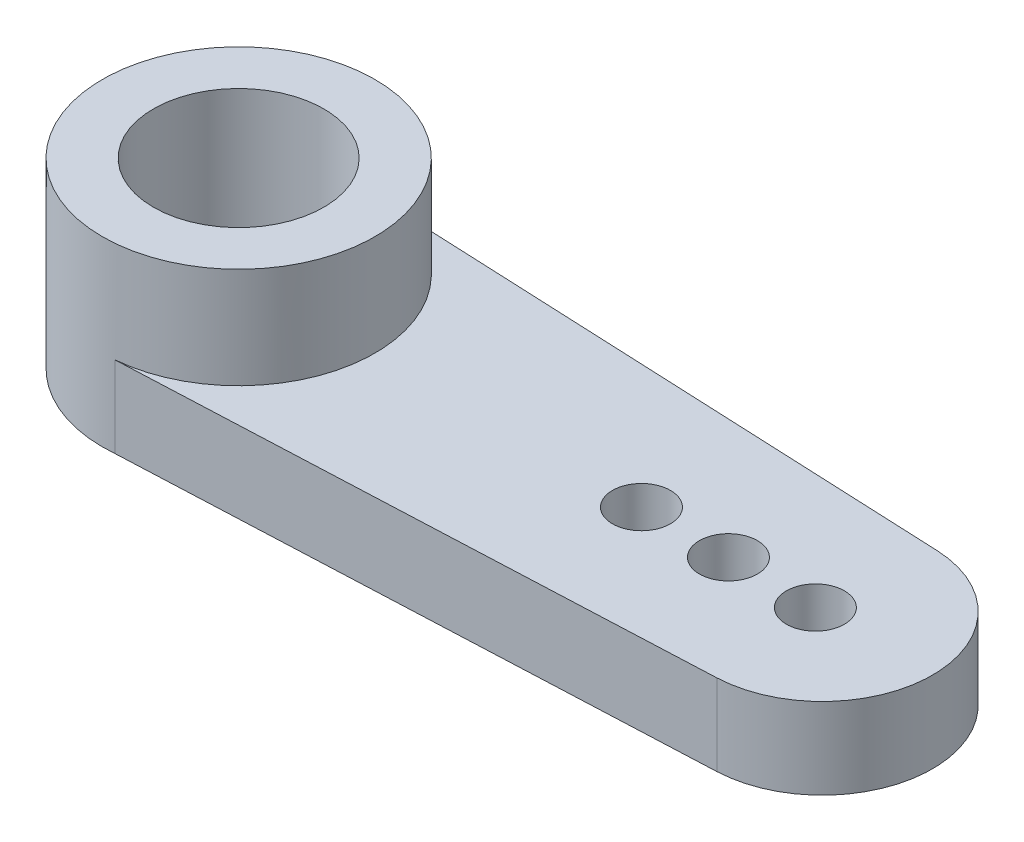
from build123d import *

# Parameters (mm, degrees)
SKETCH1_R           = 2.9845
SKETCH1_R_2         = 1.8669
BOSS_EXTRUDE1_DEPTH = 3.9878
BOSS_EXTRUDE2_DEPTH = 1.778
SKETCH3_R           = 0.635
CUT_EXTRUDE1_DEPTH  = 16.994250438


with BuildPart() as part:
    # Sketch1 → Boss-Extrude1 (new body)
    with BuildSketch(Plane(origin=(0, 0, 0), x_dir=(1, 0, 0), z_dir=(0, 1, 0))):
        Circle(SKETCH1_R)
        Circle(SKETCH1_R_2, mode=Mode.SUBTRACT)
    extrude(amount=BOSS_EXTRUDE1_DEPTH)

    # Sketch2 → Boss-Extrude2 (add)
    with BuildSketch(Plane.XZ):
        with BuildLine():
            Line((12.8905, 2.413), (0.264116324, 2.972790409))
            ThreePointArc((0.264116324, 2.972790409), (2.201760139, 2.01481824), (2.9845, 0))
            ThreePointArc((2.9845, 0), (2.201760139, -2.01481824), (0.264116324, -2.972790409))
            Line((0.264116324, -2.972790409), (12.8905, -2.413))
            ThreePointArc((12.8905, -2.413), (15.198890025, 0), (12.8905, 2.413))
        make_face()
    extrude(amount=-BOSS_EXTRUDE2_DEPTH)

    # Sketch3 → Cut-Extrude1 (cut, through all)
    with BuildSketch(Plane.XZ):
        with Locations((8.823490025, 0)):
            Circle(SKETCH3_R)
        with Locations((10.728490025, 0)):
            Circle(SKETCH3_R)
        with Locations((12.633490025, 0)):
            Circle(SKETCH3_R)
    extrude(amount=-CUT_EXTRUDE1_DEPTH, mode=Mode.SUBTRACT)


solid = part.part
